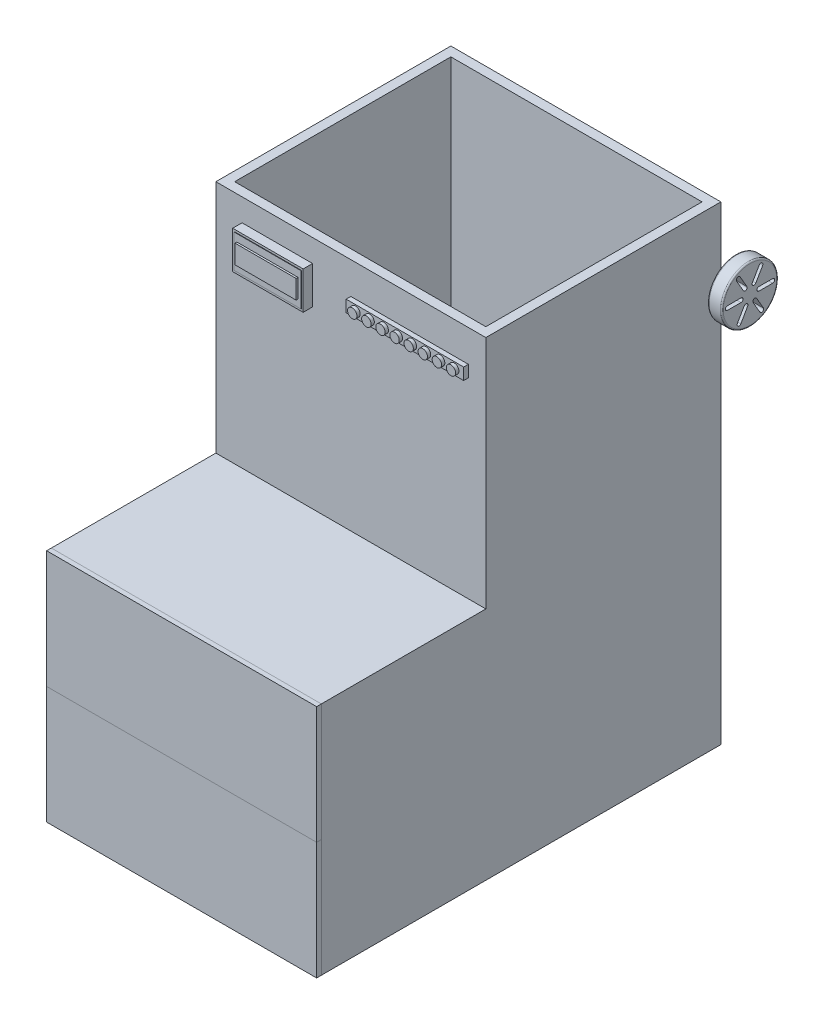
from build123d import *

# Parameters (mm, degrees)
SKETCH1_W              = 100
SKETCH1_H              = 57.44
BOSS_EXTRUDE1_DEPTH    = 50
SHELL1_T               = -2
SKETCH2_W              = 57.44
SKETCH2_H              = 50
BOSS_EXTRUDE2_DEPTH    = 35
SHELL2_START           = 50
SHELL2_OUTLINE_W       = 53.44
SHELL2_OUTLINE_H       = 46
SHELL2_DEPTH           = 35
SKETCH4_W              = 57.44
SKETCH4_H              = 25
BOSS_EXTRUDE3_DEPTH    = 1
SKETCH5_W              = 57.44
SKETCH5_H              = 25
BOSS_EXTRUDE4_DEPTH    = 1
SKETCH6_W              = 15
SKETCH6_H              = 8
BOSS_EXTRUDE5_DEPTH    = 2
SKETCH7_W              = 13
SKETCH7_H              = 4
BOSS_EXTRUDE6_DEPTH    = 0.5
SKETCH8_W              = 25
SKETCH8_H              = 2.5
BOSS_EXTRUDE7_DEPTH    = 1
SKETCH10_R             = 1
BOSS_EXTRUDE8_DEPTH    = 0.7
LPATTERN1_COUNT        = 8
LPATTERN1_PITCH        = 3
SKETCH14_W             = 5
SKETCH14_H             = 5
BOSS_EXTRUDE9_DEPTH    = 0.7
SKETCH15_W             = 5
SKETCH15_H             = 5
BOSS_EXTRUDE10_DEPTH   = 0.7
SKETCH16_R             = 0.5
BOSS_EXTRUDE11_DEPTH   = 0.7
SKETCH17_R             = 6
BOSS_EXTRUDE12_DEPTH   = 3
CUT_EXTRUDE2_DEPTH     = 3
FILLET2_R              = 0.3
FILLET3_R              = 0.3
SKETCH21_W             = 14.282115165
SKETCH21_H             = 7.06082098
BOSS_EXTRUDE14_DEPTH   = 0.1
SKETCH22_R             = 5
BOSS_EXTRUDE15_DEPTH   = 1
FILLET4_R              = 0.3
SKETCH23_R             = 1.25
BOSS_EXTRUDE16_DEPTH   = 0.5
BOSS_EXTRUDE16_2_DEPTH = 0.5
SKETCH24_W             = 1.77160124
SKETCH24_H             = 2.744234262
BOSS_EXTRUDE17_DEPTH   = 1
SKETCH25_R             = 0.375
BOSS_EXTRUDE18_DEPTH   = 1
SKETCH26_R             = 3.129718302
BOSS_EXTRUDE19_DEPTH   = 8.5
FILLET5_R              = 2


# Read off the part's stored shape, not the designer's step: Shell2
with BuildPart() as part:
    # Sketch1 → Boss-Extrude1 (new body)
    with BuildSketch(Plane(origin=(0, 0, 0), x_dir=(0, 1, 0), z_dir=(0, 0, 1))):
        Rectangle(SKETCH1_W, SKETCH1_H)
    extrude(amount=BOSS_EXTRUDE1_DEPTH)

    # Shell1
    shell1_openings = [part.faces().sort_by_distance(p)[0] for p in [
        (0, 50, 25),
    ]]
    offset(amount=SHELL1_T, openings=shell1_openings, kind=Kind.INTERSECTION)

    # Sketch2 → Boss-Extrude2 (add)
    with BuildSketch(Plane.XY.offset(50)):
        with Locations((0, -25)):
            Rectangle(SKETCH2_W, SKETCH2_H)
    extrude(amount=BOSS_EXTRUDE2_DEPTH)

    # Shell2 outline → Shell2 (cut)
    with BuildSketch(Plane.XY.offset(SHELL2_START)):
        with Locations((0, -25)):
            Rectangle(SHELL2_OUTLINE_W, SHELL2_OUTLINE_H)
    extrude(amount=SHELL2_DEPTH, mode=Mode.SUBTRACT)



with BuildPart() as body_2:
    # Sketch4 → Boss-Extrude3 (new body)
    with BuildSketch(Plane.XY.offset(85)):
        with Locations((0, -12.5)):
            Rectangle(SKETCH4_W, SKETCH4_H)
    extrude(amount=BOSS_EXTRUDE3_DEPTH)


with BuildPart() as body_3:
    # Sketch5 → Boss-Extrude4 (new body)
    with BuildSketch(Plane.XY.offset(85)):
        with Locations((0, -37.5)):
            Rectangle(SKETCH5_W, SKETCH5_H)
    extrude(amount=BOSS_EXTRUDE4_DEPTH)


with BuildPart() as body_4:
    # Sketch6 → Boss-Extrude5 (new body)
    with BuildSketch(Plane.XY.offset(50)):
        with Locations((-15.644467807, 41.215105917)):
            Rectangle(SKETCH6_W, SKETCH6_H)
    extrude(amount=BOSS_EXTRUDE5_DEPTH)



with BuildPart() as body_5:
    # Sketch7 → Boss-Extrude6 (new body)
    with BuildSketch(Plane.XY.offset(52)):
        with Locations((-15.644467807, 41.215105917)):
            Rectangle(SKETCH7_W, SKETCH7_H)
    extrude(amount=BOSS_EXTRUDE6_DEPTH)


with BuildPart() as body_6:
    # Sketch8 → Boss-Extrude7 (new body)
    with BuildSketch(Plane.XY.offset(50)):
        with Locations((12.5, 41.965105917)):
            Rectangle(SKETCH8_W, SKETCH8_H)
    extrude(amount=BOSS_EXTRUDE7_DEPTH)


with BuildPart() as part_1:
    add(part.part)

    add(body_6.part)  # Boss-Extrude8 merges body 6
    # Sketch10 → Boss-Extrude8 (add)
    with BuildSketch(Plane.XY.offset(51)):
        with Locations((2, 41.965105917)):
            Circle(SKETCH10_R)
    boss_extrude8 = extrude(amount=BOSS_EXTRUDE8_DEPTH)

    # LPattern1: Boss-Extrude8 ×8
    with Locations(*[(i * LPATTERN1_PITCH, 0, 0) for i in range(1, LPATTERN1_COUNT)]):
        add(boss_extrude8)

    # Sketch15 → Boss-Extrude10 (add)
    with BuildSketch(Plane(origin=(-28.72, 0, 0), x_dir=(0, -1, 0), z_dir=(-1, 0, 0))):
        with Locations((-33.530837204, -2.5)):
            Rectangle(SKETCH15_W, SKETCH15_H)
    boss_extrude10 = extrude(amount=-BOSS_EXTRUDE10_DEPTH)

    # Sketch16 → Boss-Extrude11 (add)
    with BuildSketch(Plane(origin=(-28.72, 0, 0), x_dir=(0, -1, 0), z_dir=(-1, 0, 0))):
        with Locations(Location((-33.530837204, -2.5, 0), (0, 0, 90))):
            Circle(SKETCH16_R)
    boss_extrude11 = extrude(amount=BOSS_EXTRUDE11_DEPTH)

    # Sketch17 → Boss-Extrude12 (add)
    with BuildSketch(Plane(origin=(-29.42, 0, 0), x_dir=(0, -1, 0), z_dir=(-1, 0, 0))):
        with Locations(Location((-33.530837204, -2.5, 0), (0, 0, 90))):
            Circle(SKETCH17_R)
    boss_extrude12 = extrude(amount=BOSS_EXTRUDE12_DEPTH)

    # Sketch18 → Cut-Extrude2 (cut)
    with BuildSketch(Plane(origin=(-32.42, 0, 0), x_dir=(0, -1, 0), z_dir=(-1, 0, 0))):
        with BuildLine():
            Line((-33.009232829, 2.314581648), (-33.009232829, -0.587095025))
            ThreePointArc((-33.009232829, -0.587095025), (-33.433890312, -1.011752509), (-33.858547796, -0.587095025))
            Line((-33.858547796, -0.587095025), (-33.858547796, 2.314581648))
            ThreePointArc((-33.858547796, 2.314581648), (-33.433890312, 2.739239132), (-33.009232829, 2.314581648))
        make_face()
        with BuildLine():
            Line((-29.525142485, 0.191096522), (-32.038068197, -1.259741815))
            ThreePointArc((-32.038068197, -1.259741815), (-32.193503624, -1.839834726), (-31.613410713, -1.995270153))
            Line((-31.613410713, -1.995270153), (-29.100485001, -0.544431816))
            ThreePointArc((-29.100485001, -0.544431816), (-28.945049574, 0.035661095), (-29.525142485, 0.191096522))
        make_face()
        with BuildLine():
            Line((-29.197431892, -4.623485126), (-31.710357605, -3.172646789))
            ThreePointArc((-31.710357605, -3.172646789), (-32.290450516, -3.328082216), (-32.135015089, -3.908175127))
            Line((-32.135015089, -3.908175127), (-29.622089376, -5.359013464))
            ThreePointArc((-29.622089376, -5.359013464), (-29.041996465, -5.203578037), (-29.197431892, -4.623485126))
        make_face()
        with BuildLine():
            Line((-33.203126612, -7.314581648), (-33.203126612, -4.412904975))
            ThreePointArc((-33.203126612, -4.412904975), (-33.627784096, -3.988247491), (-34.05244158, -4.412904975))
            Line((-34.05244158, -4.412904975), (-34.05244158, -7.314581648))
            ThreePointArc((-34.05244158, -7.314581648), (-33.627784096, -7.739239132), (-33.203126612, -7.314581648))
        make_face()
        with BuildLine():
            Line((-37.536531924, -5.191096522), (-35.023606211, -3.740258185))
            ThreePointArc((-35.023606211, -3.740258185), (-34.868170784, -3.160165274), (-35.448263695, -3.004729847))
            Line((-35.448263695, -3.004729847), (-37.961189408, -4.455568184))
            ThreePointArc((-37.961189408, -4.455568184), (-38.116624835, -5.035661095), (-37.536531924, -5.191096522))
        make_face()
        with BuildLine():
            Line((-37.864242516, -0.376514874), (-35.351316803, -1.827353211))
            ThreePointArc((-35.351316803, -1.827353211), (-34.771223892, -1.671917784), (-34.926659319, -1.091824873))
            Line((-34.926659319, -1.091824873), (-37.439585032, 0.359013464))
            ThreePointArc((-37.439585032, 0.359013464), (-38.019677943, 0.203578037), (-37.864242516, -0.376514874))
        make_face()
    cut_extrude2 = extrude(amount=-CUT_EXTRUDE2_DEPTH, mode=Mode.SUBTRACT)

    # Mirror6: Boss-Extrude10, Boss-Extrude11, Boss-Extrude12 across plane
    add(boss_extrude10.mirror(Plane(origin=(0, 0, 0), x_dir=(0, 0, 1), z_dir=(1, 0, 0))))
    add(boss_extrude11.mirror(Plane(origin=(0, 0, 0), x_dir=(0, 0, 1), z_dir=(1, 0, 0))))
    add(boss_extrude12.mirror(Plane(origin=(0, 0, 0), x_dir=(0, 0, 1), z_dir=(1, 0, 0))))

    # Mirror6 2: Cut-Extrude2 across plane
    add(cut_extrude2.mirror(Plane(origin=(0, 0, 0), x_dir=(0, 0, 1), z_dir=(1, 0, 0))), mode=Mode.SUBTRACT)

    # Fillet2
    fillet2_edges = [part_1.edges().sort_by_distance(p)[0] for p in [
        (32.42, 33.530837204, -8.5),
        (29.42, 33.530837204, -8.5),
    ]]
    fillet(fillet2_edges, radius=FILLET2_R)

    # Fillet3
    fillet3_edges = [part_1.edges().sort_by_distance(p)[0] for p in [
        (-29.42, 33.530837204, -8.5),
        (-32.42, 33.530837204, -8.5),
    ]]
    fillet(fillet3_edges, radius=FILLET3_R)


with BuildPart() as body_6_2:
    # Sketch14 → Boss-Extrude9 (new body)
    with BuildSketch(Plane.YZ.offset(28.72)):
        with Locations((33.530837204, -2.5)):
            Rectangle(SKETCH14_W, SKETCH14_H)
    extrude(amount=-BOSS_EXTRUDE9_DEPTH)


with BuildPart() as body_4_1:
    add(body_4.part)

    add(body_5.part)  # Boss-Extrude14 merges body 5

    add(part_1.part)  # Boss-Extrude14 merges part
    # Sketch21 → Boss-Extrude14 (add)
    with BuildSketch(Plane.XY.offset(52)):
        with Locations((-15.625744608, 41.235935379)):
            Rectangle(SKETCH21_W, SKETCH21_H)
    extrude(amount=BOSS_EXTRUDE14_DEPTH)

    # Sketch22 → Boss-Extrude15 (add)
    with BuildSketch(Plane(origin=(0, 0, 0), x_dir=(1, 0, 0), z_dir=(0, 0, -1))):
        with Locations(Location((0, 36.343797684, 0), (0, 0, 180))):
            Circle(SKETCH22_R)
    extrude(amount=BOSS_EXTRUDE15_DEPTH)

    # Fillet4
    fillet4_edges = [body_4_1.edges().sort_by_distance(p)[0] for p in [
        (5, -36.343797684, 0),
        (5, -36.343797684, -1),
    ]]
    fillet(fillet4_edges, radius=FILLET4_R)

    # Sketch24 → Boss-Extrude17 (add)
    with BuildSketch(Plane.XZ.offset(50)):
        with Locations((-25.847963479, -1.372117131)):
            Rectangle(SKETCH24_W, SKETCH24_H)
    extrude(amount=-BOSS_EXTRUDE17_DEPTH)

    # Sketch25 → Boss-Extrude18 (add)
    with BuildSketch(Plane(origin=(0, 0, -2.744234262), x_dir=(1, 0, 0), z_dir=(0, 0, -1))):
        with Locations(Location((-26.286058242, 49.477537684, 0), (0, 0, 180))):
            Circle(SKETCH25_R)
        with Locations(Location((-25.41086698, 49.477537684, 0), (0, 0, 180))):
            Circle(SKETCH25_R)
    extrude(amount=BOSS_EXTRUDE18_DEPTH)

    # Sketch26 → Boss-Extrude19 (add)
    with BuildSketch(Plane.YX.offset(1)):
        with Locations(Location((-36.630574146, 0, 0), (0, 0, 270))):
            Circle(SKETCH26_R)
    extrude(amount=BOSS_EXTRUDE19_DEPTH)

    # Fillet5
    fillet5_edges = [body_4_1.edges().sort_by_distance(p)[0] for p in [
        (3.129718302, -36.630574146, -1),
        (3.129718302, -36.630574146, -9.5),
    ]]
    fillet(fillet5_edges, radius=FILLET5_R)


with BuildPart() as body_5_2:
    # Sketch23 → Boss-Extrude16 (new body)
    with BuildSketch(Plane.XZ.offset(50)):
        with Locations(Location((-2.5, 4.54140043, 0), (0, 0, 270))):
            Circle(SKETCH23_R)
    extrude(amount=BOSS_EXTRUDE16_DEPTH)


with BuildPart() as body_6_3:
    # Sketch23 → Boss-Extrude16 2 (new body)
    with BuildSketch(Plane.XZ.offset(50)):
        with Locations(Location((2.5, 4.54140043, 0), (0, 0, 270))):
            Circle(SKETCH23_R)
    extrude(amount=BOSS_EXTRUDE16_2_DEPTH)


solid = Compound([body_2.part, body_3.part, body_6_2.part, body_4_1.part, body_5_2.part, body_6_3.part])
